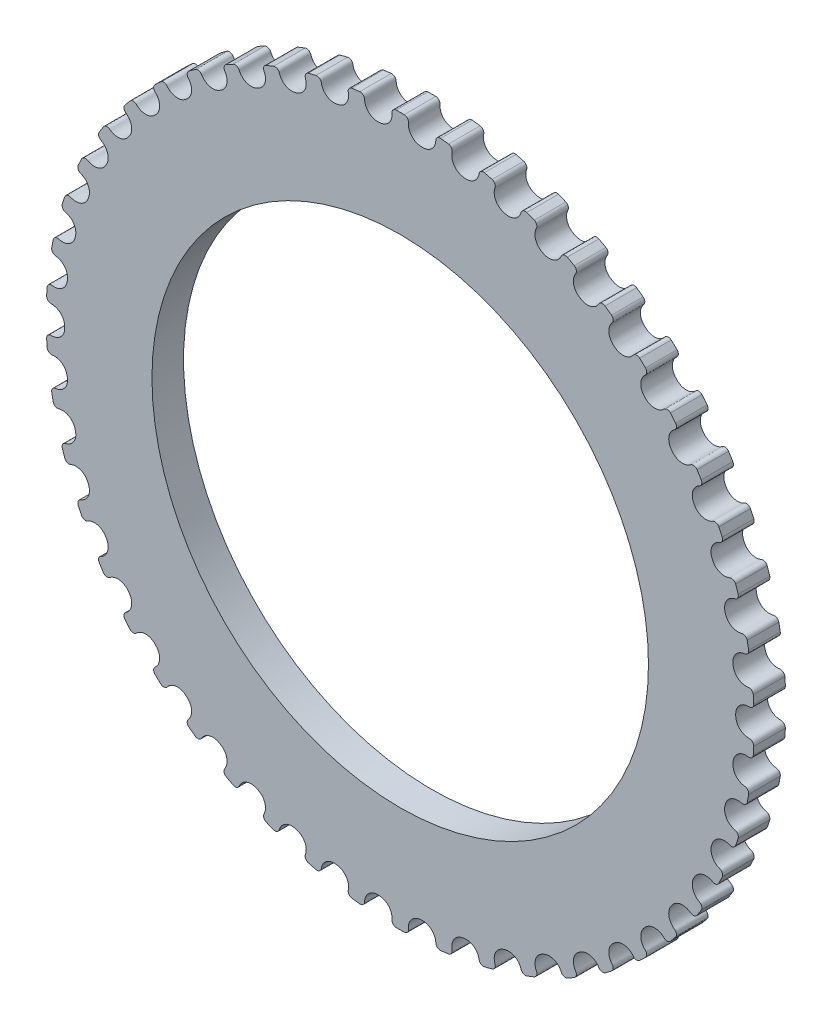
from build123d import *

# Parameters (mm, degrees)
SKETCHREVOLVEGEARBELT01_W       = 3.5
SKETCHREVOLVEGEARBELT01_H       = 39.217218411
TOOTHEXTRUDECUTGEARBELT01_DEPTH = 7.238999891
PATTERNGEARBELT01_COUNT         = 50
BOREREVOLVESKETCH_W             = 14.477999782
BOREREVOLVESKETCH_H             = 27.5


with BuildPart() as part:
    # SketchRevolveGearBelt01 → GearBelt01 (revolve)
    with BuildSketch(Plane(origin=(0, 0, 0), x_dir=(0, 0, -1), z_dir=(1, 0, 0))):
        with Locations((0, 19.608609206)):
            Rectangle(SKETCHREVOLVEGEARBELT01_W, SKETCHREVOLVEGEARBELT01_H)
    revolve(axis=Axis((0, 0, 0), (0, 0, -1)))

    # SketchToothGearBelt01 → ToothExtrudeCutGearBelt01 (cut, symmetric)
    with BuildSketch(Plane.XY):
        with BuildLine():
            ThreePointArc((39.164679022, 2.032334243), (39.217374535, 0), (39.164679022, -2.032334243))
            add(Edge.make_bspline(
                [(39.164679022, -2.032334243), (39.166048883, -2.005984565), (39.164883295, -1.966294001), (39.156943231, -1.91408071), (39.147835553, -1.875531869), (39.135634795, -1.83784758), (39.12042125, -1.801275572), (39.102294908, -1.766056265), (39.081374934, -1.732421187), (39.057798852, -1.700591449), (39.031721649, -1.670776298), (39.003314752, -1.64317173), (38.972764904, -1.617959231), (38.940272938, -1.59530448), (38.906052449, -1.575356646), (38.870328405, -1.558245974), (38.833335623, -1.544088262), (38.795317397, -1.532964211), (38.756523252, -1.524993116), (38.717209712, -1.520055082), (38.66580266, -1.5184582), (38.589994052, -1.519756698), (38.489697952, -1.516042965), (38.377509936, -1.502613699), (38.266707897, -1.480535762), (38.157982142, -1.449806634), (38.052000418, -1.410652745), (37.949416183, -1.363305357), (37.850861265, -1.308058822), (37.756942857, -1.245252774), (37.668239537, -1.175274325), (37.585297771, -1.098554529), (37.50862852, -1.015566038), (37.43870413, -0.926820101), (37.375955295, -0.832863447), (37.320768875, -0.73427489), (37.27348376, -0.631661826), (37.234395318, -0.525656278), (37.203729181, -0.416911781), (37.181730901, -0.306096466), (37.168324647, -0.193899714), (37.165224472, -0.105119728), (37.165512565, -0.040500395), (37.16545238, 0), (37.165512565, 0.040500395), (37.165224472, 0.105119728), (37.168324647, 0.193899714), (37.181730901, 0.306096466), (37.203729181, 0.416911781), (37.234395318, 0.525656278), (37.27348376, 0.631661826), (37.320768875, 0.73427489), (37.375955295, 0.832863447), (37.43870413, 0.926820101), (37.50862852, 1.015566038), (37.585297771, 1.098554529), (37.668239537, 1.175274325), (37.756942857, 1.245252774), (37.850861265, 1.308058822), (37.949416183, 1.363305357), (38.052000418, 1.410652745), (38.157982142, 1.449806634), (38.266707897, 1.480535762), (38.377509936, 1.502613699), (38.489697952, 1.516042965), (38.589994052, 1.519756698), (38.66580266, 1.5184582), (38.717209712, 1.520055082), (38.756523252, 1.524993116), (38.795317397, 1.532964211), (38.833335623, 1.544088262), (38.870328405, 1.558245974), (38.906052449, 1.575356646), (38.940272938, 1.59530448), (38.972764904, 1.617959231), (39.003314752, 1.64317173), (39.031721649, 1.670776298), (39.057798852, 1.700591449), (39.081374934, 1.732421187), (39.102294908, 1.766056265), (39.12042125, 1.801275572), (39.135634795, 1.83784758), (39.147835553, 1.875531869), (39.156943231, 1.91408071), (39.164883295, 1.966294001), (39.166048883, 2.005984565), (39.164679022, 2.032334243)],
                knots=[0, 0, 0, 0, 0.012346399, 0.018519598, 0.024692797, 0.030865997, 0.037039196, 0.043212395, 0.049385595, 0.055558794, 0.061731993, 0.067905193, 0.074078392, 0.080251591, 0.086424791, 0.09259799, 0.09877119, 0.104944389, 0.111117588, 0.117290788, 0.123463987, 0.135171051, 0.152780618, 0.170390185, 0.187999752, 0.205609319, 0.223218886, 0.240828453, 0.25843802, 0.276047587, 0.293657154, 0.311266721, 0.328876288, 0.346485855, 0.364095422, 0.381704989, 0.399314555, 0.416924122, 0.434533689, 0.452143256, 0.469752823, 0.48736239, 0.493681195, 0.5, 0.506318805, 0.51263761, 0.530247177, 0.547856744, 0.565466311, 0.583075878, 0.600685445, 0.618295011, 0.635904578, 0.653514145, 0.671123712, 0.688733279, 0.706342846, 0.723952413, 0.74156198, 0.759171547, 0.776781114, 0.794390681, 0.812000248, 0.829609815, 0.847219382, 0.864828949, 0.876536013, 0.882709212, 0.888882412, 0.895055611, 0.90122881, 0.90740201, 0.913575209, 0.919748409, 0.925921608, 0.932094807, 0.938268007, 0.944441206, 0.950614405, 0.956787605, 0.962960804, 0.969134003, 0.975307203, 0.981480402, 0.987653601, 1, 1, 1, 1], degree=3))
        make_face()
    toothextrudecutgearbelt01 = extrude(amount=TOOTHEXTRUDECUTGEARBELT01_DEPTH, both=True, mode=Mode.SUBTRACT)

    # PatternGearBelt01: ToothExtrudeCutGearBelt01 ×50 about axis
    patterngearbelt01_axis = Axis((0, 0, 55), (0, 0, -1))
    for i in range(1, PATTERNGEARBELT01_COUNT):
        add(toothextrudecutgearbelt01.rotate(patterngearbelt01_axis, i * 360 / PATTERNGEARBELT01_COUNT), mode=Mode.SUBTRACT)

    # BoreRevolveSketch → BoreRevolveCut (revolve, cut)
    with BuildSketch(Plane(origin=(0, 0, 0), x_dir=(0, 0, -1), z_dir=(1, 0, 0))):
        with Locations((0, 13.75)):
            Rectangle(BOREREVOLVESKETCH_W, BOREREVOLVESKETCH_H)
    revolve(axis=Axis((0, 0, 0), (0, 0, -1)), mode=Mode.SUBTRACT)


solid = part.part
